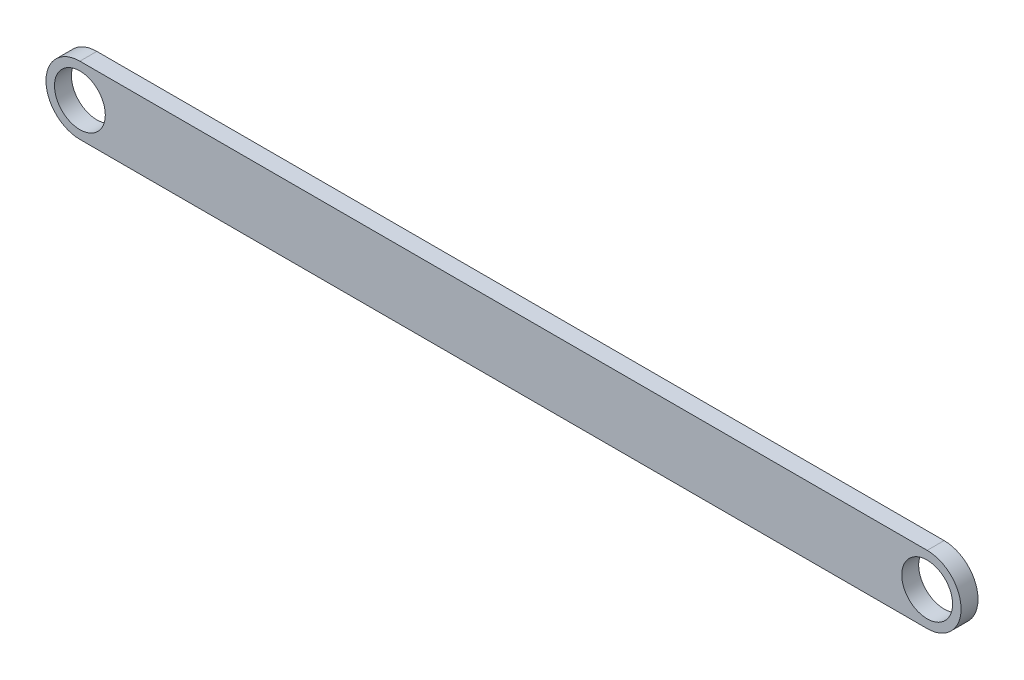
from build123d import *

# Parameters (mm, degrees)
SKETCH_1_R      = 15
EXTRUDE_3_DEPTH = 10


with BuildPart() as part:
    # Эскиз1 → Бобышка-Вытянуть3 (new body)
    with BuildSketch(Plane.XY):
        with BuildLine():
            Line((0, 20), (500, 20))
            ThreePointArc((500, 20), (520, 0), (500, -20))
            Line((500, -20), (0, -20))
            ThreePointArc((0, -20), (-20, 0), (0, 20))
        make_face()
        Circle(SKETCH_1_R, mode=Mode.SUBTRACT)
        with Locations((500, 0)):
            Circle(SKETCH_1_R, mode=Mode.SUBTRACT)
    extrude(amount=EXTRUDE_3_DEPTH)


solid = part.part
